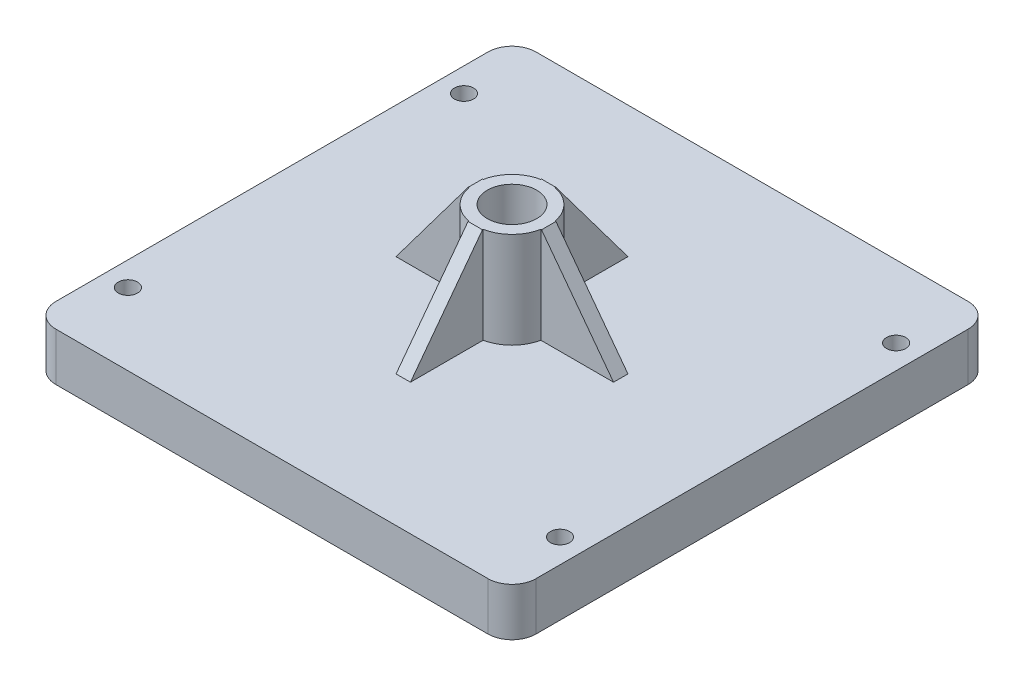
from build123d import *

# Parameters (mm, degrees)
SKETCH1_W           = 100
SKETCH1_H           = 100
BOSS_EXTRUDE1_DEPTH = 10
SKETCH2_R           = 2
CUT_EXTRUDE1_DEPTH  = 72.414284285
SKETCH3_R           = 7.65
SKETCH3_R_2         = 5.15
EXTRUDE_THIN1_DEPTH = 20
RIB1_START          = -1.5
RIB1_DEPTH          = 3
CIRPATTERN1_COUNT   = 4
FILLET1_R           = 5
CUT_EXTRUDE3_DEPTH  = 7


with BuildPart() as part:
    # Sketch1 → Boss-Extrude1 (new body)
    with BuildSketch(Plane(origin=(0, 0, 0), x_dir=(1, 0, 0), z_dir=(0, 1, 0))):
        Rectangle(SKETCH1_W, SKETCH1_H)
    extrude(amount=BOSS_EXTRUDE1_DEPTH)

    # Sketch2 → Cut-Extrude1 (cut, through all)
    with BuildSketch(Plane(origin=(0, 10, 0), x_dir=(1, 0, 0), z_dir=(0, 1, 0))):
        with Locations(Location((-45, 35, 0), (0, 0, 270))):
            Circle(SKETCH2_R)
        with Locations(Location((45, 35, 0), (0, 0, 270))):
            Circle(SKETCH2_R)
        with Locations(Location((45, -35, 0), (0, 0, 270))):
            Circle(SKETCH2_R)
        with Locations(Location((-45, -35, 0), (0, 0, 270))):
            Circle(SKETCH2_R)
    extrude(amount=-CUT_EXTRUDE1_DEPTH, mode=Mode.SUBTRACT)

    # Sketch3 → Extrude-Thin1 (add)
    with BuildSketch(Plane(origin=(0, 10, 0), x_dir=(1, 0, 0), z_dir=(0, 1, 0))):
        Circle(SKETCH3_R)
        Circle(SKETCH3_R_2, mode=Mode.SUBTRACT)
    extrude(amount=EXTRUDE_THIN1_DEPTH)

    # Rib1: read off the stored shape, not the designer's step
    # Rib1 outline → Rib1 (add)
    with BuildSketch(Plane.XY.offset(RIB1_START)):
        Polygon((-7.50149985, 30), (-7.65, 30), (-22.65, 10), (-7.50149985, 10), align=None)
    rib1 = extrude(amount=RIB1_DEPTH)

    # CirPattern1: Rib1 ×4 about axis
    cirpattern1_axis = Axis((0, 0, 0), (0, 1, 0))
    for i in range(1, CIRPATTERN1_COUNT):
        add(rib1.rotate(cirpattern1_axis, i * 360 / CIRPATTERN1_COUNT))

    # Fillet1
    fillet1_edges = [part.edges().sort_by_distance(p)[0] for p in [
        (50, 5, 50),
        (-50, 5, 50),
        (-50, 5, -50),
        (50, 5, -50),
    ]]
    fillet(fillet1_edges, radius=FILLET1_R)

    # Sketch6 → Cut-Extrude3 (cut)
    with BuildSketch(Plane.XZ):
        Polygon((4.67653718, -8.1), (9.353074361, 0), (4.67653718, 8.1), (-4.67653718, 8.1), (-9.353074361, 0), (-4.67653718, -8.1), align=None)
    extrude(amount=-CUT_EXTRUDE3_DEPTH, mode=Mode.SUBTRACT)


solid = part.part
